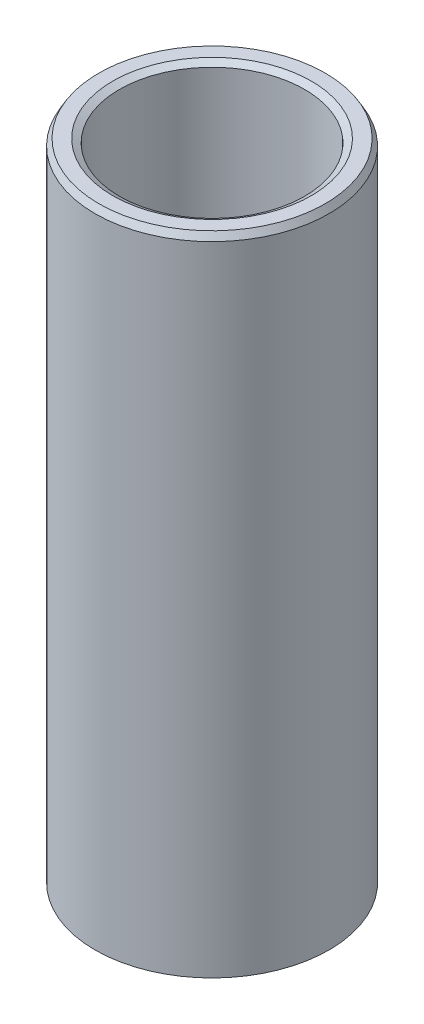
from build123d import *
from OCP.BRepFilletAPI import BRepFilletAPI_MakeChamfer

# Parameters (mm, degrees)
SKETCH1_R           = 50
BOSS_EXTRUDE1_DEPTH = 276.908699703
SKETCH2_R           = 39.564593269
CUT_EXTRUDE1_DEPTH  = 286.79438058
CHAMFER1_SIZE       = 2.852688715
CHAMFER1_SIZE2      = 1.647000597


with BuildPart() as part:
    # Sketch1 → Boss-Extrude1 (new body)
    with BuildSketch(Plane(origin=(0, 0, 0), x_dir=(1, 0, 0), z_dir=(0, 1, 0))):
        Circle(SKETCH1_R)
    extrude(amount=BOSS_EXTRUDE1_DEPTH)

    # Sketch2 → Cut-Extrude1 (cut, through all)
    with BuildSketch(Plane(origin=(0, 0, 0), x_dir=(1, 0, 0), z_dir=(0, 1, 0))):
        Circle(SKETCH2_R)
    extrude(amount=CUT_EXTRUDE1_DEPTH, mode=Mode.SUBTRACT)

    # Chamfer1: one chamfer whose edges measure the first distance from different faces: ONE call of the kernel's chamfer builder (chamfer() names one face for all edges)
    chamfer1_edges_1 = [part.edges().sort_by_distance(p)[0] for p in [
        (-39.564593269, 276.908699703, 0),
    ]]
    chamfer1_side_1 = [part.faces().sort_by_distance(p)[0] for p in [
        (-48.585786438, 276.908699703, 0),
    ]]
    chamfer1_edges_2 = [part.edges().sort_by_distance(p)[0] for p in [
        (-39.564593269, 0, 0),
    ]]
    chamfer1_side_2 = [part.faces().sort_by_distance(p)[0] for p in [
        (-39.564593269, 138.454349852, 0),
    ]]
    chamfer1_edges_3 = [part.edges().sort_by_distance(p)[0] for p in [
        (-50, 0, 0),
    ]]
    chamfer1_side_3 = [part.faces().sort_by_distance(p)[0] for p in [
        (-48.585786438, 0, 0),
    ]]
    chamfer1_edges_4 = [part.edges().sort_by_distance(p)[0] for p in [
        (-50, 276.908699703, 0),
    ]]
    chamfer1_side_4 = [part.faces().sort_by_distance(p)[0] for p in [
        (-50, 138.454349852, 0),
    ]]
    chamfer1 = BRepFilletAPI_MakeChamfer(part.part.solid().wrapped)
    for e in chamfer1_edges_1:
        chamfer1.Add(CHAMFER1_SIZE, CHAMFER1_SIZE2, e.wrapped, chamfer1_side_1[0].wrapped)  # the first distance lies on this face
    for e in chamfer1_edges_2:
        chamfer1.Add(CHAMFER1_SIZE, CHAMFER1_SIZE2, e.wrapped, chamfer1_side_2[0].wrapped)  # the first distance lies on this face
    for e in chamfer1_edges_3:
        chamfer1.Add(CHAMFER1_SIZE, CHAMFER1_SIZE2, e.wrapped, chamfer1_side_3[0].wrapped)  # the first distance lies on this face
    for e in chamfer1_edges_4:
        chamfer1.Add(CHAMFER1_SIZE, CHAMFER1_SIZE2, e.wrapped, chamfer1_side_4[0].wrapped)  # the first distance lies on this face
    add(Compound.cast(chamfer1.Shape()), mode=Mode.REPLACE)


solid = part.part
